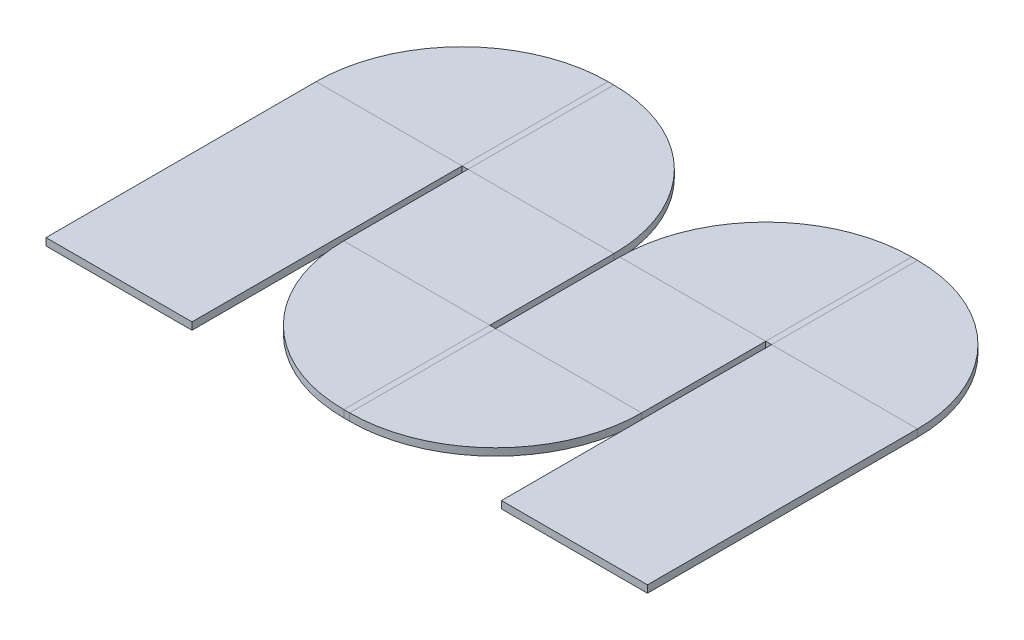
from build123d import *

# Parameters (mm, degrees)
SKETCH6_W = 63.5
SKETCH6_H = 3.175


with BuildPart() as part:
    # Sweep1: sweep along a path in Sketch1
    with BuildLine(Plane(origin=(0, 0, 0), x_dir=(1, 0, 0), z_dir=(0, 1, 0))) as sweep1_path:
        Line((0, 0), (0, 117.475))
        ThreePointArc((0, 117.475), (9.299359697, 139.925640303), (31.75, 149.225))
        Line((31.75, 149.225), (34.29, 149.225))
        ThreePointArc((34.29, 149.225), (56.740640303, 139.925640303), (66.04, 117.475))
        Line((66.04, 117.475), (66.04, 63.5))
        ThreePointArc((66.04, 63.5), (75.339359697, 41.049359697), (97.79, 31.75))
        Line((97.79, 31.75), (100.33, 31.75))
        ThreePointArc((100.33, 31.75), (122.780640303, 41.049359697), (132.08, 63.5))
        Line((132.08, 63.5), (132.08, 117.475))
        ThreePointArc((132.08, 117.475), (141.379359697, 139.925640303), (163.83, 149.225))
        Line((163.83, 149.225), (166.37, 149.225))
        ThreePointArc((166.37, 149.225), (188.820640303, 139.925640303), (198.12, 117.475))
        Line((198.12, 117.475), (198.12, 0))
    # Sketch6 → Sweep1 (sweep)
    with BuildSketch(Plane.XY):
        with Locations((0, -17.4625)):
            Rectangle(SKETCH6_W, SKETCH6_H)
    sweep(path=sweep1_path.line)


solid = part.part
